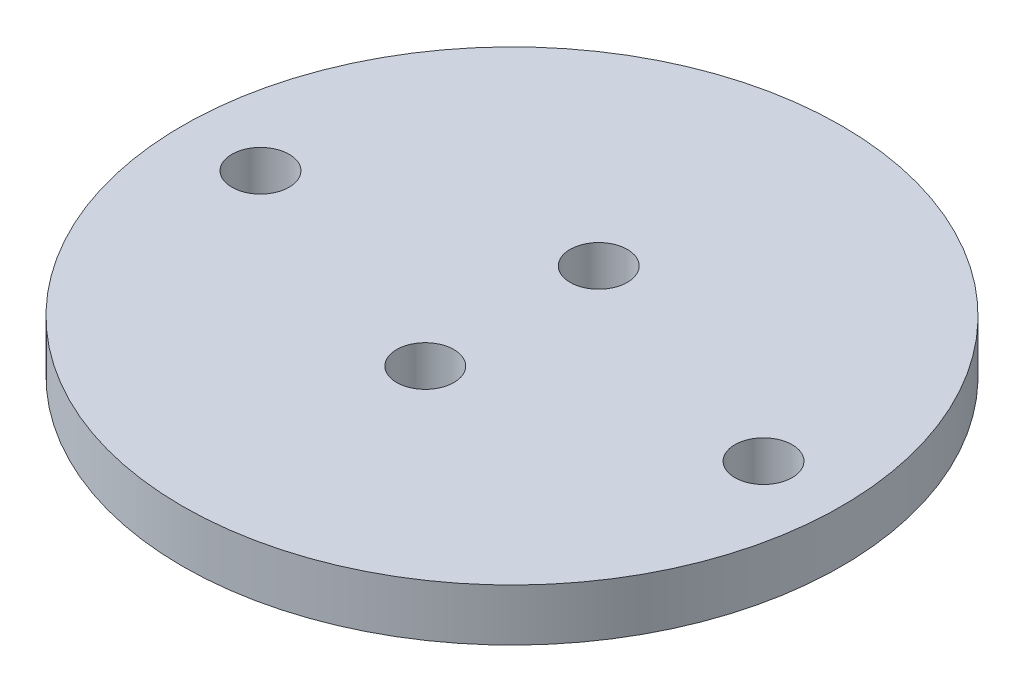
from build123d import *

# Parameters (mm, degrees)
SKETCH1_R           = 19
SKETCH1_R_2         = 1.65
BOSS_EXTRUDE1_DEPTH = 3


with BuildPart() as part:
    # Sketch1 → Boss-Extrude1 (new body)
    with BuildSketch(Plane(origin=(0, 0, 0), x_dir=(1, 0, 0), z_dir=(0, 1, 0))):
        Circle(SKETCH1_R)
        with Locations((-14.5, 0)):
            Circle(SKETCH1_R_2, mode=Mode.SUBTRACT)
        with Locations((14.5, 0)):
            Circle(SKETCH1_R_2, mode=Mode.SUBTRACT)
        with Locations((0, 5)):
            Circle(SKETCH1_R_2, mode=Mode.SUBTRACT)
        with Locations((0, -5)):
            Circle(SKETCH1_R_2, mode=Mode.SUBTRACT)
    extrude(amount=BOSS_EXTRUDE1_DEPTH)


solid = part.part
